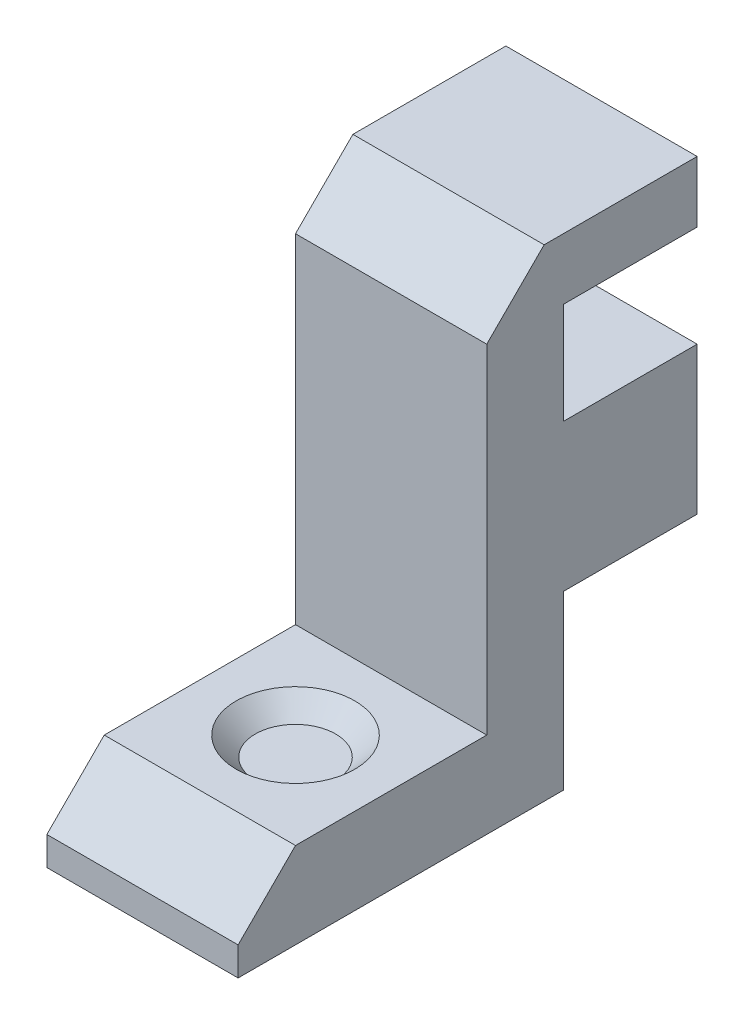
from build123d import *

# Parameters (mm, degrees)
SKETCH1_W           = 10
SKETCH1_H           = 25.2
BOSS_EXTRUDE1_DEPTH = 4
SKETCH2_W           = 10
SKETCH2_H           = 3.2
SKETCH2_H_2         = 7.7
BOSS_EXTRUDE2_DEPTH = 7
SKETCH3_W           = 10
SKETCH3_H           = 4.5
BOSS_EXTRUDE3_DEPTH = 13
SKETCH4_R           = 3.1
CUT_EXTRUDE2_DEPTH  = 1
CHAMFER2_SIZE       = 1
CHAMFER3_SIZE       = 3


with BuildPart() as part:
    # Sketch1 → Boss-Extrude1 (new body)
    with BuildSketch(Plane.XY):
        with Locations((5, 12.6)):
            Rectangle(SKETCH1_W, SKETCH1_H)
    extrude(amount=BOSS_EXTRUDE1_DEPTH)

    # Sketch2 → Boss-Extrude2 (add)
    with BuildSketch(Plane(origin=(0, 0, 0), x_dir=(-1, 0, 0), z_dir=(0, 0, -1))):
        with Locations((-5, 23.6)):
            Rectangle(SKETCH2_W, SKETCH2_H)
        with Locations((-5, 12.85)):
            Rectangle(SKETCH2_W, SKETCH2_H_2)
    extrude(amount=BOSS_EXTRUDE2_DEPTH)

    # Sketch3 → Boss-Extrude3 (add)
    with BuildSketch(Plane.XY.offset(4)):
        with Locations((5, 2.25)):
            Rectangle(SKETCH3_W, SKETCH3_H)
    extrude(amount=BOSS_EXTRUDE3_DEPTH)

    # Sketch4 → Cut-Extrude2 (cut)
    with BuildSketch(Plane(origin=(0, 4.5, 0), x_dir=(1, 0, 0), z_dir=(0, 1, 0))):
        with Locations(Location((5, -9, 0), (0, 0, 270))):
            Circle(SKETCH4_R)
    extrude(amount=-CUT_EXTRUDE2_DEPTH, mode=Mode.SUBTRACT)

    # Chamfer2
    chamfer2_edges = [part.edges().sort_by_distance(p)[0] for p in [
        (5, 3.5, 5.9),
    ]]
    chamfer(chamfer2_edges, length=CHAMFER2_SIZE - 0.0001)  # a hair under: the kernel refuses the full size

    # Chamfer3
    chamfer3_edges = [part.edges().sort_by_distance(p)[0] for p in [
        (5, 25.2, 4),
        (5, 4.5, 17),
    ]]
    chamfer(chamfer3_edges, length=CHAMFER3_SIZE)


solid = part.part
